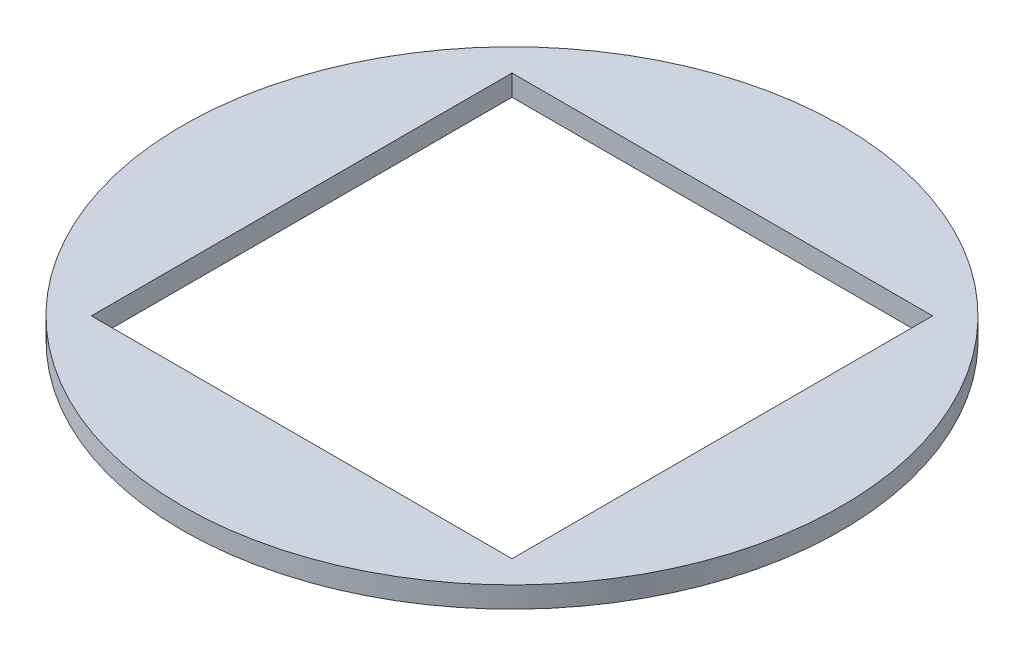
from build123d import *

# Parameters (mm, degrees)
SKETCH1_R           = 78.35
SKETCH1_W           = 100
SKETCH1_H           = 100
BOSS_EXTRUDE1_DEPTH = 5


with BuildPart() as part:
    # Sketch1 → Boss-Extrude1 (new body)
    with BuildSketch(Plane(origin=(0, 0, 0), x_dir=(1, 0, 0), z_dir=(0, 1, 0))):
        Circle(SKETCH1_R)
        Rectangle(SKETCH1_W, SKETCH1_H, mode=Mode.SUBTRACT)
    extrude(amount=BOSS_EXTRUDE1_DEPTH)


solid = part.part
